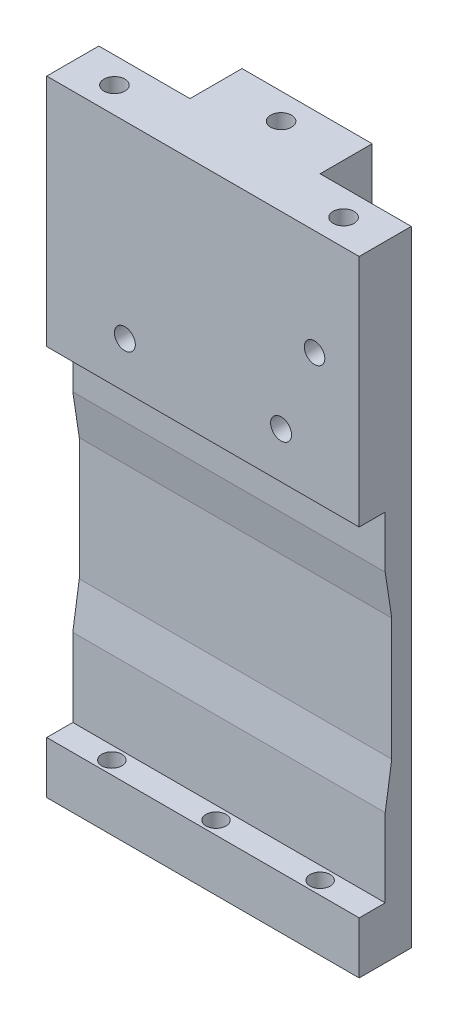
from build123d import *

# Parameters (mm, degrees)
BOSS_EXTRUDE1_DEPTH              = 76.2
CUT_EXTRUDE3_DEPTH               = 47.625
CUT_EXTRUDE4_DEPTH               = 110.433918417
F_10_0_1935_DIAMETER_HOLE1_D     = 4.9149
F_10_0_1935_DIAMETER_HOLE1_DEPTH = 19.05
F_10_0_1935_DIAMETER_HOLE1_TIP   = 1.476584928
F_1_4_20_TAPPED_HOLE1_D          = 5.1054
SKETCH19_R                       = 2.499999953
CUT_EXTRUDE5_DEPTH               = 87.135590889
F_1_4_20_TAPPED_HOLE2_D          = 5.1054
F_1_4_20_TAPPED_HOLE2_DEPTH      = 20.691183098
F_1_4_20_TAPPED_HOLE2_TIP        = 1.533816902
F_1_4_20_TAPPED_HOLE3_D          = 5.1054
F_1_4_20_TAPPED_HOLE3_DEPTH      = 9.05002
F_1_4_20_TAPPED_HOLE3_TIP        = 1.533816902
F_1_4_20_TAPPED_HOLE4_D          = 5.1054
F_1_4_20_TAPPED_HOLE4_DEPTH      = 7.356183098
F_1_4_20_TAPPED_HOLE4_TIP        = 1.533816902


with BuildPart() as part:
    # Sketch1 → Boss-Extrude1 (new, symmetric)
    with BuildSketch(Plane(origin=(0, 0, 0), x_dir=(1, 0, 0), z_dir=(0, 1, 0))):
        Polygon((-15.875, 6.35), (-15.875, 19.05), (15.875, 19.05), (15.875, 6.35), (38.1, 6.35), (38.1, -6.35), (-38.1, -6.35), (-38.1, 6.35), align=None)
    extrude(amount=BOSS_EXTRUDE1_DEPTH, both=True)

    # Sketch5 → Cut-Extrude3 (cut, symmetric)
    with BuildSketch(Plane(origin=(0, 0, 0), x_dir=(1, 0, 0), z_dir=(0, 1, 0))):
        with BuildLine():
            Line((-4.7625, 19.05), (-4.7625, 12.7))
            ThreePointArc((-4.7625, 12.7), (0, 7.9375), (4.7625, 12.7))
            Line((4.7625, 12.7), (4.7625, 19.05))
            Line((4.7625, 19.05), (-4.7625, 19.05))
        make_face()
    extrude(amount=CUT_EXTRUDE3_DEPTH, both=True, mode=Mode.SUBTRACT)

    # Sketch9 → Cut-Revolve1 (revolve, cut)
    with BuildSketch(Plane(origin=(0, 0, 0), x_dir=(0, 0, -1), z_dir=(1, 0, 0))):
        with BuildLine():
            Line((19.05, -52.3875), (12.7, -52.3875))
            ThreePointArc((12.7, -52.3875), (9.332403955, -50.992596045), (7.9375, -47.625))
            Line((7.9375, -47.625), (19.05, -47.625))
            Line((19.05, -47.625), (19.05, -52.3875))
        make_face()
    cut_revolve1 = revolve(axis=Axis((0, -47.625, -7.9375), (0, 0, -1)), mode=Mode.SUBTRACT)

    # Mirror1: Cut-Revolve1 across plane
    add(cut_revolve1.mirror(Plane.ZX), mode=Mode.SUBTRACT)

    # Sketch12 → Cut-Extrude4 (cut, through all)
    with BuildSketch(Plane(origin=(38.1, 0, 0), x_dir=(0, 0, -1), z_dir=(1, 0, 0))):
        Polygon((-6.35, -63.5), (0, -63.5), (0, -44.45), (1.5875, -33.956087115), (1.5875, -4.143912885), (0, 6.35), (0, 19.05), (-6.35, 19.05), align=None)
    extrude(amount=-CUT_EXTRUDE4_DEPTH, mode=Mode.SUBTRACT)

    # #10 (0.1935) Diameter Hole1
    with Locations(Plane(origin=(0, -76.2, 0), x_dir=(-1, 0, 0), z_dir=(0, -1, 0))):
        with Locations((25.4, -3.175), (-25.4, -3.175), (0, -3.175)):
            Hole(F_10_0_1935_DIAMETER_HOLE1_D / 2, depth=F_10_0_1935_DIAMETER_HOLE1_DEPTH)
            with Locations((0, 0, -(F_10_0_1935_DIAMETER_HOLE1_DEPTH + F_10_0_1935_DIAMETER_HOLE1_TIP / 2))):  # 118° drill point
                Cone(0, F_10_0_1935_DIAMETER_HOLE1_D / 2, F_10_0_1935_DIAMETER_HOLE1_TIP, mode=Mode.SUBTRACT)

    # 1/4-20 Tapped Hole1 (through all)
    with Locations(Plane(origin=(0, 76.2, 0), x_dir=(1, 0, 0), z_dir=(0, 1, 0))):
        with Locations((0, 12.7)):
            Hole(F_1_4_20_TAPPED_HOLE1_D / 2)

    # Sketch19 → Cut-Extrude5 (cut, through all)
    with BuildSketch(Plane(origin=(0, 0, -6.35), x_dir=(-1, 0, 0), z_dir=(0, 0, -1))):
        with Locations((-27.209019229, 50.43691079)):
            Circle(SKETCH19_R)
    extrude(amount=-CUT_EXTRUDE5_DEPTH, mode=Mode.SUBTRACT)

    # 1/4-20 Tapped Hole2
    with Locations(Plane(origin=(0, 76.2, 0), x_dir=(1, 0, 0), z_dir=(0, 1, 0))):
        with Locations((27.94, 0), (-27.94, 0)):
            Hole(F_1_4_20_TAPPED_HOLE2_D / 2, depth=F_1_4_20_TAPPED_HOLE2_DEPTH)
            with Locations((0, 0, -(F_1_4_20_TAPPED_HOLE2_DEPTH + F_1_4_20_TAPPED_HOLE2_TIP / 2))):  # 118° drill point
                Cone(0, F_1_4_20_TAPPED_HOLE2_D / 2, F_1_4_20_TAPPED_HOLE2_TIP, mode=Mode.SUBTRACT)

    # 1/4-20 Tapped Hole3
    with Locations(Plane(origin=(0, 0, -19.05), x_dir=(-1, 0, 0), z_dir=(0, 0, -1))):
        with Locations((-9.525, -66.675), (9.525, 57.15), (-9.525, 57.15), (9.525, -66.675)):
            Hole(F_1_4_20_TAPPED_HOLE3_D / 2, depth=F_1_4_20_TAPPED_HOLE3_DEPTH)
            with Locations((0, 0, -(F_1_4_20_TAPPED_HOLE3_DEPTH + F_1_4_20_TAPPED_HOLE3_TIP / 2))):  # 118° drill point
                Cone(0, F_1_4_20_TAPPED_HOLE3_D / 2, F_1_4_20_TAPPED_HOLE3_TIP, mode=Mode.SUBTRACT)

    # 1/4-20 Tapped Hole4
    with Locations(Plane.XY.offset(6.35)):
        with Locations((19.05, 30.260695081), (-19.05, 30.260695081)):
            Hole(F_1_4_20_TAPPED_HOLE4_D / 2, depth=F_1_4_20_TAPPED_HOLE4_DEPTH)
            with Locations((0, 0, -(F_1_4_20_TAPPED_HOLE4_DEPTH + F_1_4_20_TAPPED_HOLE4_TIP / 2))):  # 118° drill point
                Cone(0, F_1_4_20_TAPPED_HOLE4_D / 2, F_1_4_20_TAPPED_HOLE4_TIP, mode=Mode.SUBTRACT)


solid = part.part
